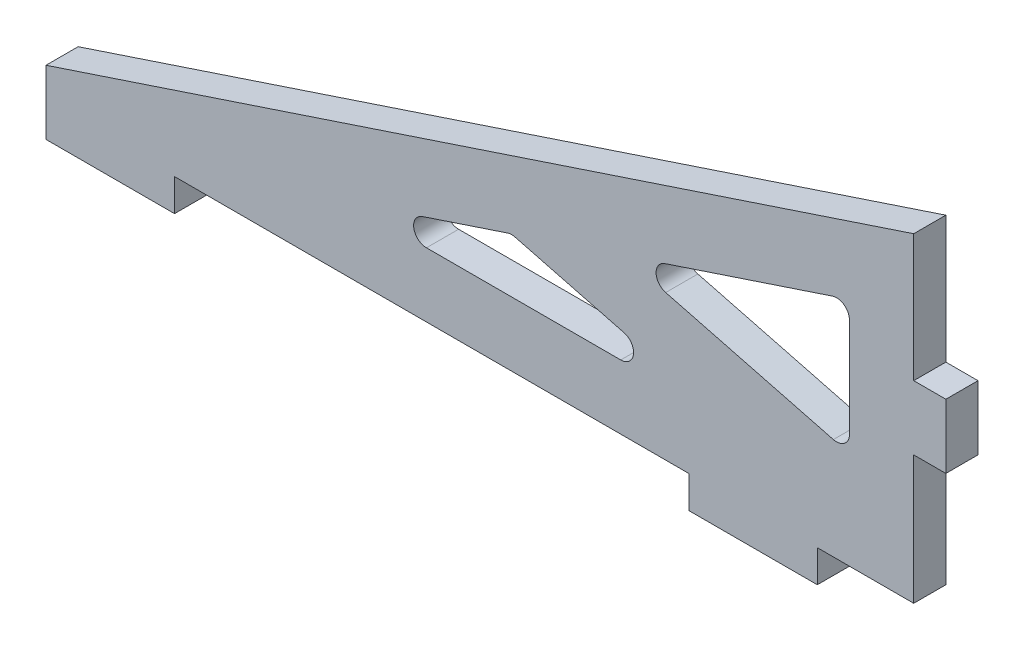
from build123d import *

# Parameters (mm, degrees)
BOSS_EXTRUDE1_DEPTH = 6.35
CUT_EXTRUDE1_DEPTH  = 226.36350526
FILLET1_R           = 2.54


with BuildPart() as part:
    # Sketch2 → Boss-Extrude1 (new body)
    with BuildSketch(Plane.XY):
        Polygon((-92.950015109, 148.30800019), (78.499984891, 205.20400019), (78.499984891, 180.05800019), (84.849984891, 180.05800019), (84.849984891, 167.35800019), (78.499984891, 167.35800019), (78.499984891, 141.95800019), (59.449984891, 141.95800019), (59.449984891, 135.60800019), (34.049984891, 135.60800019), (34.049984891, 141.95800019), (-67.550015109, 141.95800019), (-67.550015109, 135.60800019), (-92.950015109, 135.60800019), (-92.950015109, 141.95800019), align=None)
    extrude(amount=BOSS_EXTRUDE1_DEPTH)

    # Sketch3 → Cut-Extrude1 (cut, through all)
    with BuildSketch(Plane.XY.offset(6.35)):
        Polygon((-1.019446214, 165.434292154), (-33.492647443, 154.65800019), (40.515121465, 154.65800019), align=None)
        Polygon((65.799984891, 187.608444106), (21.169587996, 172.797764247), (65.799984891, 161.218248334), align=None)
    extrude(amount=-CUT_EXTRUDE1_DEPTH, mode=Mode.SUBTRACT)

    # Fillet1
    fillet1_edges = [part.edges().sort_by_distance(p)[0] for p in [
        (65.799984891, 187.608444106, 3.175),
        (21.169587996, 172.797764247, 3.175),
        (-1.019446214, 165.434292154, 3.175),
        (40.515121465, 154.65800019, 3.175),
        (-33.492647443, 154.65800019, 3.175),
        (65.799984891, 161.218248334, 3.175),
    ]]
    fillet(fillet1_edges, radius=FILLET1_R)


solid = part.part
